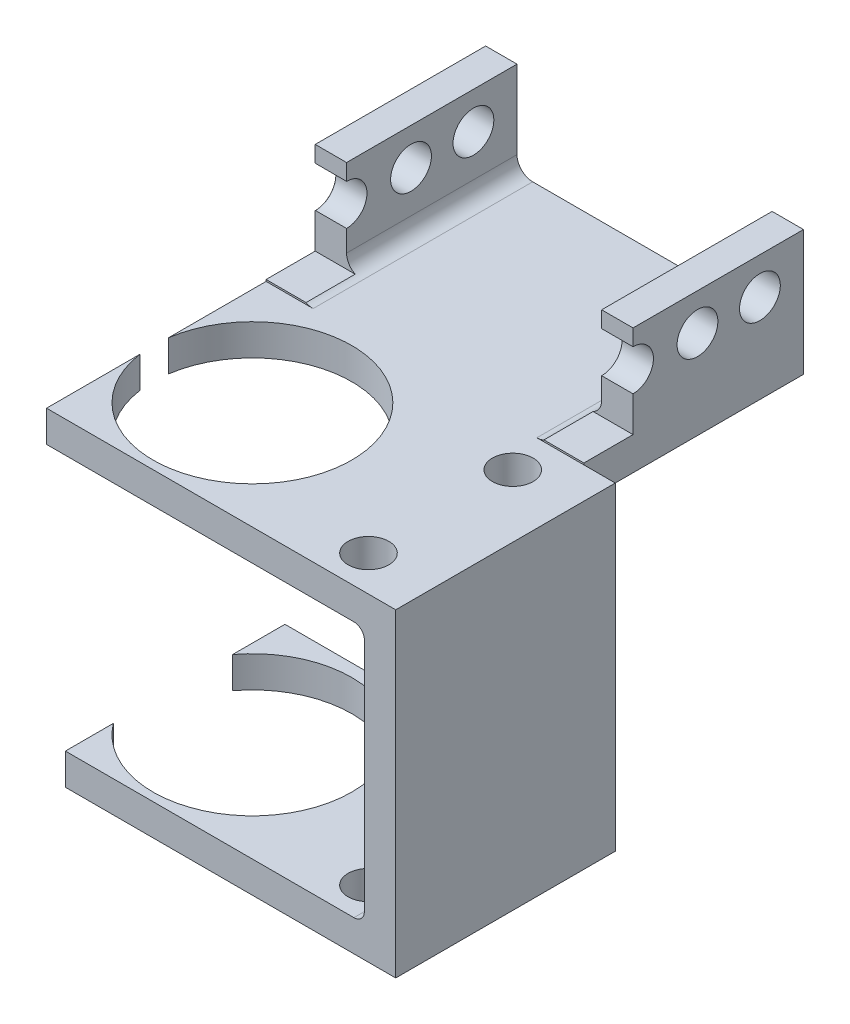
from build123d import *

# Parameters (mm, degrees)
BOSS_EXTRUDE1_DEPTH              = 21
BOSS_EXTRUDE2_DEPTH              = 21
BOSS_EXTRUDE3_DEPTH              = 21
CUT_EXTRUDE1_DEPTH               = 49.007704586
CUT_EXTRUDE1_DEPTH_BACK          = 49.007704586
SKETCH6_R                        = 9.5
M3_5_CLEARANCE_HOLE1_D           = 3.9
M3_5_CLEARANCE_HOLE1_CSINK_D     = 3.95
M3_5_CLEARANCE_HOLE1_CSINK_ANGLE = 90
FILLET1_R                        = 1
RIB16_REACH                      = 72.176
SKETCH14_WALL_W                  = 154.964977556
SKETCH14_WALL_H                  = 2
RIB17_REACH                      = 72.176
SKETCH16_WALL_W                  = 154.964977556
SKETCH16_WALL_H                  = 2
M3_5_CLEARANCE_HOLE3_D           = 3.9
M3_5_CLEARANCE_HOLE3_CSINK_D     = 3.95
M3_5_CLEARANCE_HOLE3_CSINK_ANGLE = 90
SKETCH19_W                       = 4.698020406
SKETCH19_H                       = 8.838480279
CUT_EXTRUDE2_DEPTH               = 71.890126252
FILLET2_R                        = 1.5


with BuildPart() as part:
    # Sketch1 → Boss-Extrude1 (new body)
    with BuildSketch(Plane.XY):
        Polygon((14.42095576, -21), (11.42095576, -21), (11.42095576, -30), (-12.97904424, -30), (-12.97904424, -21), (-15.97904424, -21), (-15.97904424, -33), (14.42095576, -33), align=None)
    extrude(amount=-BOSS_EXTRUDE1_DEPTH)

    # Sketch1<3> → Boss-Extrude2 (add)
    with BuildSketch(Plane.XY):
        Polygon((14.42095576, -30), (11.42095576, -30), (-12.97904424, -30), (-15.97904424, -30), (-15.97904424, -33), (14.377296505, -33), (14.42095576, -33), align=None)
    extrude(amount=BOSS_EXTRUDE2_DEPTH)

    # Sketch5 → Boss-Extrude3 (add)
    with BuildSketch(Plane.XY.offset(21)):
        Polygon((14.42095576, -30), (17.42095576, -30), (17.42095576, -60.5), (-14.17601239, -60.5), (-14.17601239, -57.5), (14.42095576, -57.5), align=None)
    extrude(amount=-BOSS_EXTRUDE3_DEPTH)

    # Sketch6 → Cut-Extrude1 (cut, two sides: drawn at the far end of the back side and taken through both)
    with BuildSketch(Plane.XZ.offset(60.5).offset(-CUT_EXTRUDE1_DEPTH_BACK)):
        with Locations((-6.57904424, 10.707170057)):
            Circle(SKETCH6_R)
    extrude(amount=CUT_EXTRUDE1_DEPTH + CUT_EXTRUDE1_DEPTH_BACK, mode=Mode.SUBTRACT)

    # M3.5 Clearance Hole1 (through all)
    with Locations(Plane(origin=(0, -60.5, 0), x_dir=(-1, 0, 0), z_dir=(0, -1, 0))):
        with Locations((-11.42095576, -17.607170057), (-11.42095576, -3.807170057)):
            CounterSinkHole(M3_5_CLEARANCE_HOLE1_D / 2, M3_5_CLEARANCE_HOLE1_CSINK_D / 2, counter_sink_angle=M3_5_CLEARANCE_HOLE1_CSINK_ANGLE)

    # Fillet1
    fillet1_edges = [part.edges().sort_by_distance(p)[0] for p in [
        (14.42095576, -33, 10.5),
        (14.42095576, -57.5, 10.5),
    ]]
    fillet(fillet1_edges, radius=FILLET1_R)

    # Sketch14 wall → Rib16 (add, up to next)
    with BuildSketch(Plane(origin=(12.92095576, -39.125, 10), x_dir=(-0.237868729379, 0.971297311632, 0), z_dir=(0.971297311632, 0.237868729379, 0)), mode=Mode.PRIVATE) as rib16_sk1:
        Rectangle(SKETCH14_WALL_W, SKETCH14_WALL_H)
    rib16_tool1 = extrude(rib16_sk1.sketch, amount=RIB16_REACH, mode=Mode.PRIVATE) - part.part
    add(rib16_tool1.solids().sort_by_distance((12.92095576, -39.125, 10))[0])

    # Sketch16 wall → Rib17 (add, up to next)
    with BuildSketch(Plane(origin=(12.92095576, -51.375, 10), x_dir=(-0.237868729379, -0.971297311632, 0), z_dir=(0.971297311632, -0.237868729379, 0)), mode=Mode.PRIVATE) as rib17_sk1:
        Rectangle(SKETCH16_WALL_W, SKETCH16_WALL_H)
    rib17_tool1 = extrude(rib17_sk1.sketch, amount=RIB17_REACH, mode=Mode.PRIVATE) - part.part
    add(rib17_tool1.solids().sort_by_distance((12.92095576, -51.375, 10))[0])

    # M3.5 Clearance Hole3 (through all)
    with Locations(Plane.ZY.offset(15.97904424)):
        with Locations((-16.833290537, -24.511498959), (-10.862238065, -24.511498959), (-4.698020406, -24.511498959)):
            CounterSinkHole(M3_5_CLEARANCE_HOLE3_D / 2, M3_5_CLEARANCE_HOLE3_CSINK_D / 2, counter_sink_angle=M3_5_CLEARANCE_HOLE3_CSINK_ANGLE)

    # Sketch19 → Cut-Extrude2 (cut, through all)
    with BuildSketch(Plane(origin=(14.42095576, 0, 0), x_dir=(0, 0, -1), z_dir=(1, 0, 0))):
        with Locations((2.349010203, -25.41924014)):
            Rectangle(SKETCH19_W, SKETCH19_H)
    extrude(amount=-CUT_EXTRUDE2_DEPTH, mode=Mode.SUBTRACT)

    # Fillet2
    fillet2_edges = [part.edges().sort_by_distance(p)[0] for p in [
        (11.42095576, -30, -10.5),
        (-12.97904424, -30, -10.5),
    ]]
    fillet(fillet2_edges, radius=FILLET2_R)


solid = part.part
